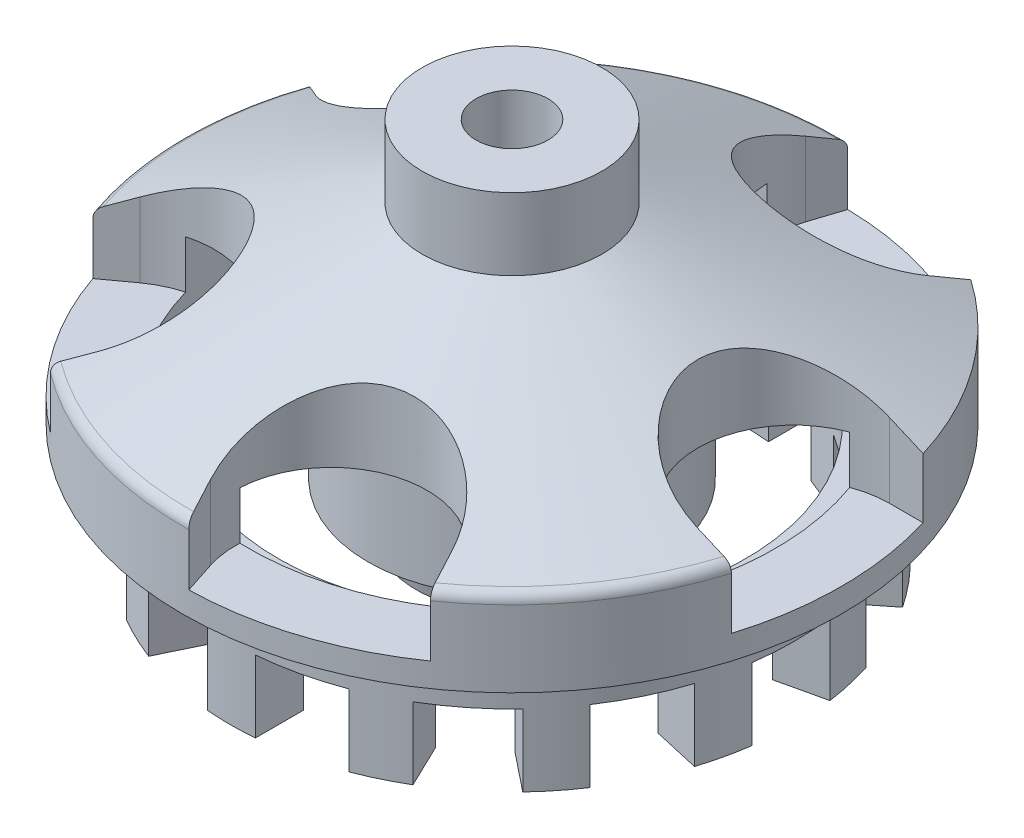
from build123d import *

# Parameters (mm, degrees)
SKETCH1_R           = 13.75
BOSS_EXTRUDE1_DEPTH = 8
SKETCH3_R           = 11.75
SKETCH3_R_2         = 9.75
BOSS_EXTRUDE2_DEPTH = 5
CUT_EXTRUDE1_START  = -3
CUT_EXTRUDE1_DEPTH  = 3
CUT_EXTRUDE2_DEPTH  = 7
CIRPATTERN1_COUNT   = 5
SKETCH6_W           = 11
SKETCH6_H           = 3
SKETCH7_R           = 3.75
BOSS_EXTRUDE3_DEPTH = 3
SKETCH11_R          = 6
BOSS_EXTRUDE4_DEPTH = 5
SKETCH12_R          = 1.5
CUT_EXTRUDE3_DEPTH  = 13
SKETCH13_R          = 4
SKETCH13_R_2        = 3
BOSS_EXTRUDE5_DEPTH = 2
CHAMFER1_SIZE2      = 2
CHAMFER1_SIZE       = 0.5
FILLET1_R           = 0.5


with BuildPart() as part:
    # Sketch1 → Boss-Extrude1 (new body)
    with BuildSketch(Plane(origin=(0, 0, 0), x_dir=(1, 0, 0), z_dir=(0, 1, 0))):
        with Locations(Location((0, 0, 0), (0, 0, 270))):
            Circle(SKETCH1_R)
    extrude(amount=BOSS_EXTRUDE1_DEPTH)

    # Sketch2 → Cut-Revolve1 (revolve, cut)
    with BuildSketch(Plane(origin=(0, 0, 0), x_dir=(0, 0, -1), z_dir=(1, 0, 0))):
        Polygon((3.75, 8), (13.75, 3.5), (13.75, 8), align=None)
    revolve(axis=Axis((0, 0, 0), (0, 1, 0)), mode=Mode.SUBTRACT)

    # Sketch3 → Boss-Extrude2 (add)
    with BuildSketch(Plane(origin=(0, 0, 0), x_dir=(-1, 0, 0), z_dir=(0, -1, 0))):
        with Locations(Location((0, 0, 0), (0, 0, 270))):
            Circle(SKETCH3_R)
        with Locations(Location((0, 0, 0), (0, 0, 90))):
            Circle(SKETCH3_R_2, mode=Mode.SUBTRACT)
    extrude(amount=BOSS_EXTRUDE2_DEPTH)

    # Sketch4 → Cut-Extrude1 (cut)
    with BuildSketch(Plane(origin=(0, -5, 0), x_dir=(-1, 0, 0), z_dir=(0, -1, 0)).offset(CUT_EXTRUDE1_START)):
        with BuildLine():
            Line((-1, -11.707369474), (-1, -9.698582371))
            ThreePointArc((-1, -9.698582371), (-2.169578632, -9.505547252), (-3.3070874, -9.172004848))
            Line((-3.3070874, -9.172004848), (-4.178667279, -10.981859577))
            ThreePointArc((-4.178667279, -10.981859577), (-2.614620403, -11.455403099), (-1, -11.707369474))
        make_face()
        with BuildLine():
            Line((-8.529699424, -8.081257807), (-6.95916655, -6.828799377))
            ThreePointArc((-6.95916655, -6.828799377), (-6.079025188, -7.622857257), (-5.109026051, -8.30423704))
            Line((-5.109026051, -8.30423704), (-5.98060611, -10.114091682))
            ThreePointArc((-5.98060611, -10.114091682), (-7.326004714, -9.186520284), (-8.529699424, -8.081257807))
        make_face()
        with BuildLine():
            Line((-11.191319987, -3.580063818), (-9.232897415, -3.13306644))
            ThreePointArc((-9.232897415, -3.13306644), (-8.784446251, -4.230366894), (-8.206146835, -5.265135718))
            Line((-8.206146835, -5.265135718), (-9.776679833, -6.517593991))
            ThreePointArc((-9.776679833, -6.517593991), (-10.586383944, -5.098134463), (-11.191319987, -3.580063818))
        make_face()
        with BuildLine():
            Line((-11.636362375, 1.630205717), (-9.677939714, 1.18320873))
            ThreePointArc((-9.677939714, 1.18320873), (-9.75, -4.86e-07), (-9.677939596, -1.183209695))
            Line((-9.677939596, -1.183209695), (-11.636362212, -1.630206877))
            ThreePointArc((-11.636362212, -1.630206877), (-11.75, -5.86e-07), (-11.636362375, 1.630205717))
        make_face()
        with BuildLine():
            Line((-9.776680484, 6.517593016), (-8.20614736, 5.2651349))
            ThreePointArc((-8.20614736, 5.2651349), (-8.784446673, 4.230366018), (-9.232897728, 3.133065519))
            Line((-9.232897728, 3.133065519), (-11.191320344, 3.580062702))
            ThreePointArc((-11.191320344, 3.580062702), (-10.586384452, 5.098133407), (-9.776680484, 6.517593016))
        make_face()
        with BuildLine():
            Line((-5.980607119, 10.114091085), (-5.109026879, 8.30423653))
            ThreePointArc((-5.109026879, 8.30423653), (-6.079025948, 7.622856651), (-6.959167231, 6.828798683))
            Line((-6.959167231, 6.828798683), (-8.52970023, 8.081256956))
            ThreePointArc((-8.52970023, 8.081256956), (-7.32600563, 9.186519554), (-5.980607119, 10.114091085))
        make_face()
        with BuildLine():
            Line((-1.000001168, 11.707369374), (-1.000000967, 9.698582271))
            ThreePointArc((-1.000000967, 9.698582271), (-2.16957958, 9.505547036), (-3.307088315, 9.172004518))
            Line((-3.307088315, 9.172004518), (-4.178668375, 10.98185916))
            ThreePointArc((-4.178668375, 10.98185916), (-2.614621545, 11.455402838), (-1.000001168, 11.707369374))
        make_face()
        with BuildLine():
            Line((4.178667279, 10.981859577), (3.3070874, 9.172004848))
            ThreePointArc((3.3070874, 9.172004848), (2.169578632, 9.505547252), (1, 9.698582371))
            Line((1, 9.698582371), (1, 11.707369474))
            ThreePointArc((1, 11.707369474), (2.614620403, 11.455403099), (4.178667279, 10.981859577))
        make_face()
        with BuildLine():
            Line((8.529699424, 8.081257807), (6.95916655, 6.828799377))
            ThreePointArc((6.95916655, 6.828799377), (6.079025188, 7.622857257), (5.109026051, 8.30423704))
            Line((5.109026051, 8.30423704), (5.98060611, 10.114091682))
            ThreePointArc((5.98060611, 10.114091682), (7.326004714, 9.186520284), (8.529699424, 8.081257807))
        make_face()
        with BuildLine():
            Line((11.191319987, 3.580063818), (9.232897415, 3.13306644))
            ThreePointArc((9.232897415, 3.13306644), (8.784446251, 4.230366894), (8.206146835, 5.265135718))
            Line((8.206146835, 5.265135718), (9.776679833, 6.517593991))
            ThreePointArc((9.776679833, 6.517593991), (10.586383944, 5.098134463), (11.191319987, 3.580063818))
        make_face()
        with BuildLine():
            Line((11.636362375, -1.630205717), (9.677939714, -1.18320873))
            ThreePointArc((9.677939714, -1.18320873), (9.75, 4.86e-07), (9.677939596, 1.183209695))
            Line((9.677939596, 1.183209695), (11.636362212, 1.630206877))
            ThreePointArc((11.636362212, 1.630206877), (11.75, 5.86e-07), (11.636362375, -1.630205717))
        make_face()
        with BuildLine():
            Line((9.776680484, -6.517593016), (8.20614736, -5.2651349))
            ThreePointArc((8.20614736, -5.2651349), (8.784446673, -4.230366018), (9.232897728, -3.133065519))
            Line((9.232897728, -3.133065519), (11.191320344, -3.580062702))
            ThreePointArc((11.191320344, -3.580062702), (10.586384452, -5.098133407), (9.776680484, -6.517593016))
        make_face()
        with BuildLine():
            Line((5.980607119, -10.114091085), (5.109026879, -8.30423653))
            ThreePointArc((5.109026879, -8.30423653), (6.079025948, -7.622856651), (6.959167231, -6.828798683))
            Line((6.959167231, -6.828798683), (8.52970023, -8.081256956))
            ThreePointArc((8.52970023, -8.081256956), (7.32600563, -9.186519554), (5.980607119, -10.114091085))
        make_face()
        with BuildLine():
            Line((1.000001168, -11.707369374), (1.000000967, -9.698582271))
            ThreePointArc((1.000000967, -9.698582271), (2.16957958, -9.505547036), (3.307088315, -9.172004518))
            Line((3.307088315, -9.172004518), (4.178668375, -10.98185916))
            ThreePointArc((4.178668375, -10.98185916), (2.614621545, -11.455402838), (1.000001168, -11.707369374))
        make_face()
    extrude(amount=CUT_EXTRUDE1_DEPTH, mode=Mode.SUBTRACT)

    # Sketch5 → Cut-Extrude2 (cut)
    with BuildSketch(Plane(origin=(0, 8, 0), x_dir=(1, 0, 0), z_dir=(0, 1, 0))):
        with BuildLine():
            Line((45.230647112, -4), (11.75, -4))
            ThreePointArc((11.75, -4), (7.75, 0), (11.75, 4))
            Line((11.75, 4), (45.230647112, 4))
            ThreePointArc((45.230647112, 4), (49.230647112, 0), (45.230647112, -4))
        make_face()
    cut_extrude2 = extrude(amount=-CUT_EXTRUDE2_DEPTH, mode=Mode.SUBTRACT)

    # CirPattern1: Cut-Extrude2 ×5 about axis
    cirpattern1_axis = Axis((0, 0, 0), (0, 1, 0))
    for i in range(1, CIRPATTERN1_COUNT):
        add(cut_extrude2.rotate(cirpattern1_axis, i * 360 / CIRPATTERN1_COUNT), mode=Mode.SUBTRACT)

    # Sketch6 → Cut-Revolve2 (revolve, cut)
    with BuildSketch(Plane.XY, mode=Mode.PRIVATE) as cut_revolve2_sk:
        with Locations((5.5, 1.5)):
            Rectangle(SKETCH6_W, SKETCH6_H)
    revolve(cut_revolve2_sk.sketch.rotate(Axis((0, 0, 0), (0, 1, 0)), 90), axis=Axis((0, 0, 0), (0, 1, 0)), mode=Mode.SUBTRACT)

    # Sketch7 → Boss-Extrude3 (add)
    with BuildSketch(Plane(origin=(0, 8, 0), x_dir=(1, 0, 0), z_dir=(0, 1, 0))):
        with Locations(Location((0, 0, 0), (0, 0, 270))):
            Circle(SKETCH7_R)
    extrude(amount=BOSS_EXTRUDE3_DEPTH)

    # Sketch11 → Boss-Extrude4 (add)
    with BuildSketch(Plane(origin=(0, 3, 0), x_dir=(-1, 0, 0), z_dir=(0, -1, 0))):
        with Locations(Location((0, 0, 0), (0, 0, 270))):
            Circle(SKETCH11_R)
    extrude(amount=BOSS_EXTRUDE4_DEPTH)

    # Sketch12 → Cut-Extrude3 (cut)
    with BuildSketch(Plane(origin=(0, 11, 0), x_dir=(1, 0, 0), z_dir=(0, 1, 0))):
        with Locations(Location((0, 0, 0), (0, 0, 270))):
            Circle(SKETCH12_R)
    extrude(amount=-CUT_EXTRUDE3_DEPTH, mode=Mode.SUBTRACT)

    # Sketch13 → Boss-Extrude5 (add)
    with BuildSketch(Plane(origin=(0, -2, 0), x_dir=(-1, 0, 0), z_dir=(0, -1, 0))):
        with Locations(Location((0, 0, 0), (0, 0, 90))):
            Circle(SKETCH13_R)
        with Locations(Location((0, 0, 0), (0, 0, 90))):
            Circle(SKETCH13_R_2, mode=Mode.SUBTRACT)
    extrude(amount=BOSS_EXTRUDE5_DEPTH)

    # Chamfer1
    chamfer1_edges = [part.edges().sort_by_distance(p)[0] for p in [
        (0, -2, 4),
    ]]
    chamfer1_side = [part.faces().sort_by_distance(p)[0] for p in [
        (0, -2, 4.01),
    ]]
    chamfer(chamfer1_edges, length=CHAMFER1_SIZE - 0.0001, length2=CHAMFER1_SIZE2 - 0.0001, reference=chamfer1_side[0])  # a hair under: the kernel refuses the full size

    # Fillet1
    fillet1_edges = [part.edges().sort_by_distance(p)[0] for p in [
        (-4.372906972, 3.5, 13.036110793),
        (-13.75, 3.5, 0),
        (-4.372906972, 3.5, -13.036110793),
        (11.123983673, 3.5, 8.082047219),
    ]]
    fillet(fillet1_edges, radius=FILLET1_R)


solid = part.part
